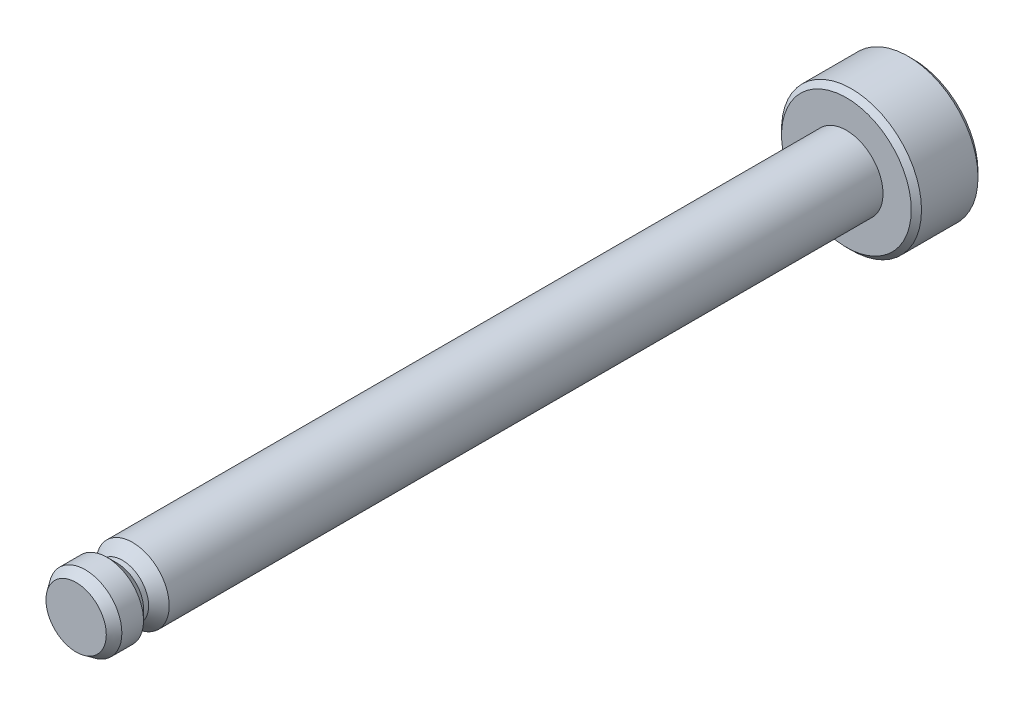
from build123d import *

# Parameters (mm, degrees)
SKETCH2_R      = 1.425
SHAFT_DEPTH    = 30
SKETCH5_R      = 2.725
HEAD_DEPTH     = 2.6
CHAMFER1_SIZE  = 0.25
CHAMFER1_SIZE2 = 0.357037002
DEBURS_SIZE    = 0.2


with BuildPart() as part:
    # Sketch2 → Shaft (new body)
    with BuildSketch(Plane.XY):
        Circle(SKETCH2_R)
    extrude(amount=SHAFT_DEPTH)

    # Sketch5 → Head (add)
    with BuildSketch(Plane.XY):
        Circle(SKETCH5_R)
    extrude(amount=-HEAD_DEPTH)

    # Chamfer1
    chamfer1_edges = [part.edges().sort_by_distance(p)[0] for p in [
        (-1.425, 0, 30),
    ]]
    chamfer1_side = [part.faces().sort_by_distance(p)[0] for p in [
        (0, 0, 30),
    ]]
    chamfer(chamfer1_edges, length=CHAMFER1_SIZE, length2=CHAMFER1_SIZE2, reference=chamfer1_side[0])

    # Deburs
    deburs_edges = [part.edges().sort_by_distance(p)[0] for p in [
        (-2.725, 0, 0),
        (-2.725, 0, -2.6),
    ]]
    chamfer(deburs_edges, length=DEBURS_SIZE)

    # Sketch6 → e-Clip Notch Long (revolve, cut)
    with BuildSketch(Plane(origin=(0, 0, 0), x_dir=(0, 0, -1), z_dir=(1, 0, 0))):
        Polygon((-28.8, 1.425), (-27.8, 1.425), (-28.2, 1.025), (-28.4, 1.025), align=None)
    revolve(axis=Axis((0, 0, 0), (0, 0, 1)), mode=Mode.SUBTRACT)


solid = part.part
